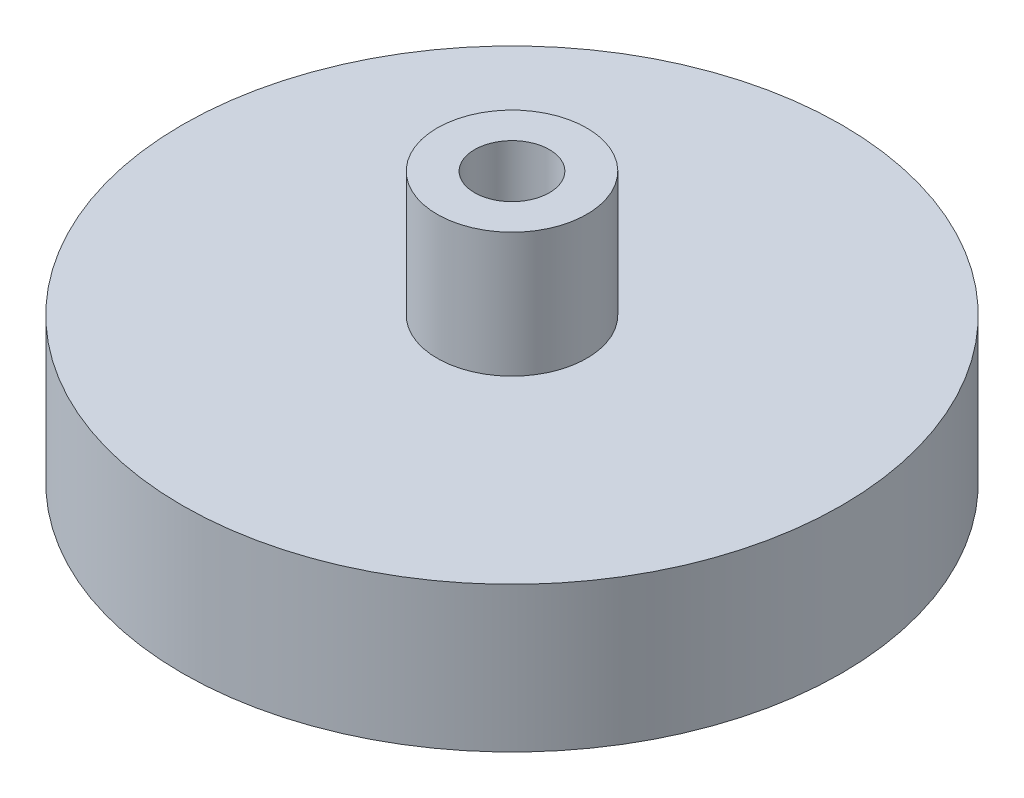
from build123d import *

# Parameters (mm, degrees)
SKETCH1_W           = 13.220206566
SKETCH1_H           = 7.652210528
SKETCH3_W           = 65.903471667
SKETCH3_H           = 45.522220295
CUT_EXTRUDE1_DEPTH  = 25
SKETCH5_R           = 1.5
CUT_EXTRUDE2_DEPTH  = 25
BOSS_EXTRUDE1_START = 5
SKETCH7_R           = 3
SKETCH7_R_2         = 1.5
BOSS_EXTRUDE1_DEPTH = 5


with BuildPart() as part:
    # Sketch1 → Revolve1 (revolve)
    with BuildSketch(Plane.XY):
        with Locations((-6.610103283, 18.573894736)):
            Rectangle(SKETCH1_W, SKETCH1_H)
    revolve(axis=Axis((0, 51.787709497, 0), (0, -1, 0)))

    # Sketch3 → Cut-Extrude1 (cut, symmetric)
    with BuildSketch(Plane.XY):
        with Locations((-0.554743028, -6.185529403)):
            Rectangle(SKETCH3_W, SKETCH3_H)
    extrude(amount=CUT_EXTRUDE1_DEPTH, both=True, mode=Mode.SUBTRACT)

    # Sketch4 → Cut-Revolve1 (revolve, cut)
    with BuildSketch(Plane.XY):
        with BuildLine():
            Line((0, 0), (0, 20.9))
            ThreePointArc((0, 20.9), (-20.9, 0), (0, -20.9))
            Line((0, -20.9), (0, 0))
        make_face()
    revolve(axis=Axis((0, 39.939026177, 0), (0, -1, 0)), mode=Mode.SUBTRACT)

    # Sketch5 → Cut-Extrude2 (cut, symmetric)
    with BuildSketch(Plane(origin=(0, 0, 0), x_dir=(1, 0, 0), z_dir=(0, 1, 0))):
        Circle(SKETCH5_R)
    extrude(amount=CUT_EXTRUDE2_DEPTH, both=True, mode=Mode.SUBTRACT)

    # Sketch7 → Boss-Extrude1 (add)
    with BuildSketch(Plane(origin=(0, 22.4, 0), x_dir=(1, 0, 0), z_dir=(0, 1, 0)).offset(BOSS_EXTRUDE1_START)):
        Circle(SKETCH7_R)
        Circle(SKETCH7_R_2, mode=Mode.SUBTRACT)
    extrude(amount=-BOSS_EXTRUDE1_DEPTH)


solid = part.part
